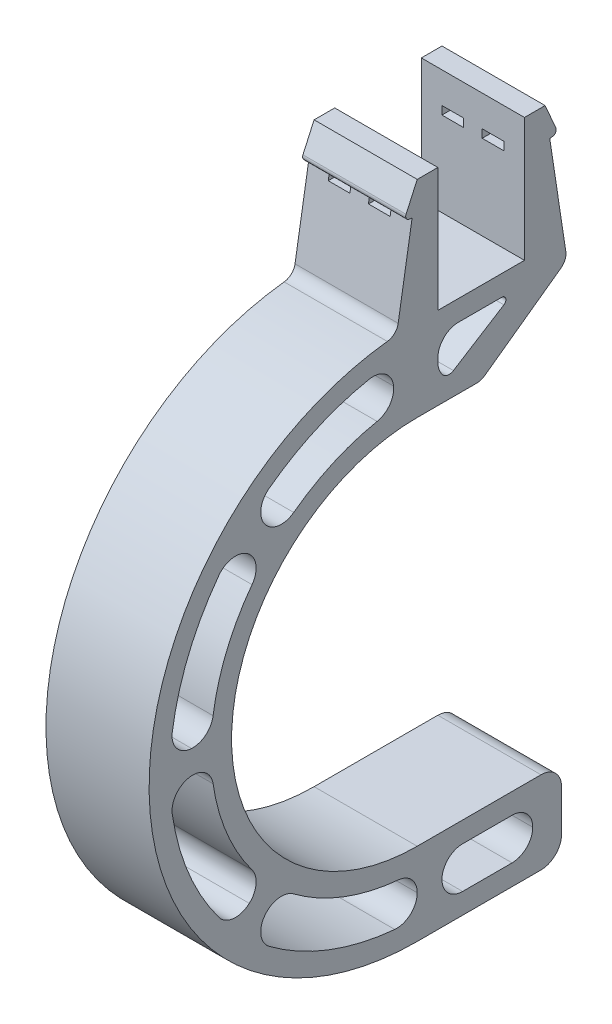
from build123d import *

# Parameters (mm, degrees)
SKETCH1_W               = 22
SKETCH1_H               = 10
BOSS_EXTRUDE1_DEPTH     = 25
FILLET1_R               = 5
FILLET2_R               = 5
FILLET3_R               = 5
FILLET4_R               = 5
FILLET5_R               = 2
FILLET6_R               = 1
FILLET7_R               = 3
FILLET8_R               = 5
CUT_EXTRUDE1_DEPTH      = 35
CUT_EXTRUDE1_DEPTH_BACK = 25
SKETCH2_W               = 5.25
SKETCH2_H               = 2
BOSS_EXTRUDE2_DEPTH     = 25
FILLET9_R               = 1


# Some blends are built 0.0001 mm under size
with BuildPart() as part:
    # Sketch1 → Boss-Extrude1 (new body)
    with BuildSketch(Plane(origin=(0, 0, 0), x_dir=(0, 0, -1), z_dir=(1, 0, 0))):
        with BuildLine():
            ThreePointArc((-15.5, -17.5), (-60.5, -62.5), (-15.5, -107.5))
            Line((-15.5, -107.5), (19.5, -107.5))
            Line((19.5, -107.5), (19.5, -127.5))
            Line((19.5, -127.5), (-15.5, -127.5))
            ThreePointArc((-15.5, -127.5), (-80.4518339, -65.001853916), (-20.5, 2.307406984))
            Line((-20.5, 2.307406984), (-15.5, 32.5))
            Line((-15.5, 32.5), (-10.5, 32.5))
            Line((-10.5, 32.5), (-10.5, 2.5))
            Line((-10.5, 2.5), (10.5, 2.5))
            Line((10.5, 2.5), (10.5, 32.5))
            Line((10.5, 32.5), (15.5, 32.5))
            Line((15.5, 32.5), (20.8, -2.5))
            Line((20.8, -2.5), (0, -17.5))
            Line((0, -17.5), (-15.5, -17.5))
        make_face()
        with BuildLine():
            ThreePointArc((-55.647836382, -107.088689529), (-37.002076973, -118.51482559), (-15.5, -122.5))
            Line((-15.5, -122.5), (-15.5, -112.5))
            ThreePointArc((-15.5, -112.5), (-33.418397477, -109.179021325), (-48.956530318, -99.657241274))
            Line((-48.956530318, -99.657241274), (-55.647836382, -107.088689529))
        make_face(mode=Mode.SUBTRACT)
        with BuildLine():
            ThreePointArc((-60.088689529, -22.352163618), (-70.932771951, -39.538994058), (-75.417772085, -59.359842625))
            Line((-75.417772085, -59.359842625), (-65.431476738, -59.883202188))
            ThreePointArc((-65.431476738, -59.883202188), (-61.693976626, -43.365828382), (-52.657241274, -29.043469682))
            Line((-52.657241274, -29.043469682), (-60.088689529, -22.352163618))
        make_face(mode=Mode.SUBTRACT)
        with BuildLine():
            ThreePointArc((-21.771707796, -2.828686278), (-39.904198585, -7.687272541), (-55.647836382, -17.911310471))
            Line((-55.647836382, -17.911310471), (-48.956530318, -25.342758726))
            ThreePointArc((-48.956530318, -25.342758726), (-35.836832154, -16.822727118), (-20.726423163, -12.773905232))
            Line((-20.726423163, -12.773905232), (-21.771707796, -2.828686278))
        make_face(mode=Mode.SUBTRACT)
        Polygon((8.463652775, -2.5), (-7.917479229, -12.773905232), (-10.5, -12.773905232), (-10.5, -2.5), align=None, mode=Mode.SUBTRACT)
        with Locations((1.5, -117.5)):
            Rectangle(SKETCH1_W, SKETCH1_H, mode=Mode.SUBTRACT)
        with BuildLine():
            Line((-65.431476738, -65.116797812), (-75.417772085, -65.640157375))
            ThreePointArc((-75.417772085, -65.640157375), (-70.932771951, -85.461005942), (-60.088689529, -102.647836382))
            Line((-60.088689529, -102.647836382), (-52.657241274, -95.956530318))
            ThreePointArc((-52.657241274, -95.956530318), (-61.693976626, -81.634171618), (-65.431476738, -65.116797812))
        make_face(mode=Mode.SUBTRACT)
    extrude(amount=-BOSS_EXTRUDE1_DEPTH)

    # Fillet1
    fillet1_edges = [part.edges().sort_by_distance(p)[0] for p in [
        (-12.5, -99.657241274, 48.956530318),
        (-12.5, -112.5, 9.5),
        (-12.5, -122.5, 9.5),
        (-12.5, -122.5, 15.5),
        (-12.5, -122.5, -12.5),
        (-12.5, -112.5, -12.5),
        (-12.5, -107.088689529, 55.647836382),
        (-12.5, -112.5, 15.5),
        (-12.5, -95.956530318, 52.657241274),
        (-12.5, -102.647836382, 60.088689529),
        (-12.5, -22.352163618, 60.088689529),
        (-12.5, -29.043469682, 52.657241274),
        (-12.5, -59.883202188, 65.431476738),
        (-12.5, -59.359842625, 75.417772085),
        (-12.5, -17.911310471, 55.647836382),
        (-12.5, -25.342758726, 48.956530318),
        (-12.5, -12.773905232, 20.726423163),
        (-12.5, -2.828686278, 21.771707796),
    ]]
    fillet(fillet1_edges, radius=FILLET1_R - 0.0001)  # a hair under: the kernel refuses the full size

    # Fillet2
    fillet2_edges = [part.edges().sort_by_distance(p)[0] for p in [
        (-12.5, -65.116797812, 65.431476738),
        (-12.5, -65.640157375, 75.417772085),
    ]]
    fillet(fillet2_edges, radius=FILLET2_R - 0.0001)  # a hair under: the kernel refuses the full size

    # Fillet3
    fillet3_edges = [part.edges().sort_by_distance(p)[0] for p in [
        (-12.5, -2.5, 10.5),
    ]]
    fillet(fillet3_edges, radius=FILLET3_R)

    # Fillet4
    # the kernel refuses this fillet: 5 mm, written as the material it adds along each edge
    with BuildSketch(Plane(origin=(0, -12.773905232, 10.5), x_dir=(0, 1, 0), z_dir=(-1, 0, 0))) as fillet4_piece_1:
        with BuildLine():
            CenterArc((4.376733277, 5), FILLET4_R, 208.91397124, 61.08602876)
            Line((0, 2.582520771), (-0.087534666, 2.534171187))
            ThreePointArc((-0.087534666, 2.534171187), (-0.1, 1.291260386), (-0.1, 0))
            Line((-0.1, 0), (0, -0.1))
            Line((0, -0.1), (4.376733277, -0.1))
            Line((4.376733277, -0.1), (4.376733277, 0))
        make_face()
    extrude(amount=25)

    # Fillet5
    fillet5_edges = [part.edges().sort_by_distance(p)[0] for p in [
        (-12.5, -12.773905232, 7.917479229),
    ]]
    fillet(fillet5_edges, radius=FILLET5_R)

    # Fillet6
    fillet6_edges = [part.edges().sort_by_distance(p)[0] for p in [
        (-12.5, -2.5, -8.463652775),
    ]]
    fillet(fillet6_edges, radius=FILLET6_R)

    # Fillet7
    fillet7_edges = [part.edges().sort_by_distance(p)[0] for p in [
        (-12.5, 2.307406984, 20.5),
        (-12.5, -2.5, -20.8),
        (-12.5, -17.5, 0),
    ]]
    fillet(fillet7_edges, radius=FILLET7_R)

    # Fillet8
    fillet8_edges = [part.edges().sort_by_distance(p)[0] for p in [
        (-12.5, -107.5, -19.5),
        (-12.5, -127.5, -19.5),
    ]]
    fillet(fillet8_edges, radius=FILLET8_R)

    # Sketch2 → Cut-Extrude1 (cut, two sides: drawn at the far end of the back side and taken through both)
    with BuildSketch(Plane.XY.offset(-10.5).offset(-CUT_EXTRUDE1_DEPTH_BACK)):
        with Locations((-17.375, 24)):
            Rectangle(SKETCH2_W, SKETCH2_H)
        with Locations((-7.625, 24)):
            Rectangle(SKETCH2_W, SKETCH2_H)
    extrude(amount=CUT_EXTRUDE1_DEPTH + CUT_EXTRUDE1_DEPTH_BACK, mode=Mode.SUBTRACT)

    # Sketch3 → Boss-Extrude2 (add)
    with BuildSketch(Plane(origin=(0, 0, 0), x_dir=(0, 0, -1), z_dir=(1, 0, 0))):
        Polygon((16.635714286, 25), (18.635714286, 25.302857143), (15.5, 32.5), align=None)
        Polygon((-16.742026479, 25), (-18.742026479, 25.331207061), (-15.5, 32.5), align=None)
    extrude(amount=-BOSS_EXTRUDE2_DEPTH)

    # Fillet9
    fillet9_edges = [part.edges().sort_by_distance(p)[0] for p in [
        (-12.5, 25.302857143, -18.635714286),
        (-12.5, 25.331207061, 18.742026479),
    ]]
    fillet(fillet9_edges, radius=FILLET9_R)


solid = part.part
